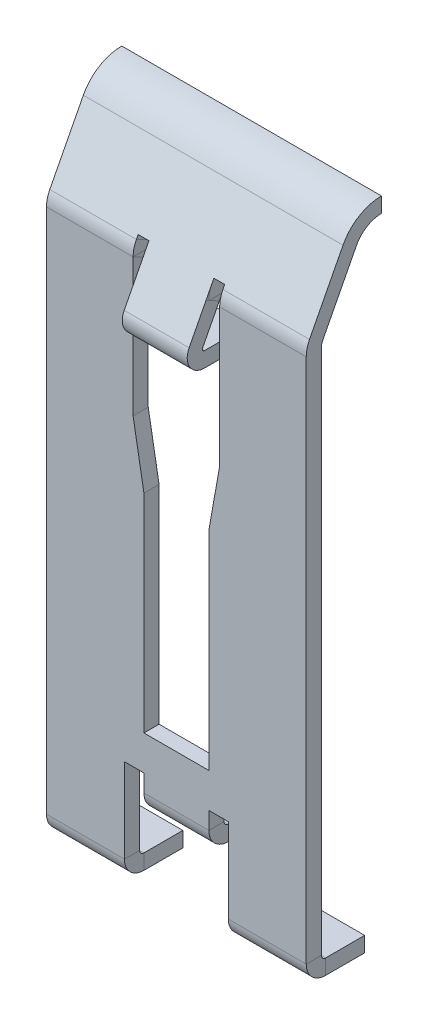
from build123d import *

# Parameters (mm, degrees)
MAIN_PLATE_DEPTH               = 0.35
EDGE_FLANGE1_STRIP_W           = 1.6
EDGE_FLANGE1_STRIP_H           = 0.35
EDGE_FLANGE1_STRIP_CUT_DEPTH   = 1.8
EDGE_FLANGE1_STRIP_2_W         = 1.6
EDGE_FLANGE1_STRIP_2_H         = 0.35
EDGE_FLANGE1_STRIP_CUT_2_DEPTH = 1.8
EDGE_FLANGE1_STRIP_3_W         = 1.6
EDGE_FLANGE1_STRIP_3_H         = 0.35
EDGE_FLANGE1_STRIP_CUT_3_DEPTH = 1.5
EDGE_FLANGE1_DEPTH             = 1.8
EDGE_FLANGE1_BEND_DEPTH        = 1.8
EDGE_FLANGE1_BEND_2_DEPTH      = 1.5
CENTRAL_SECTION_DEPTH          = 0.75
BOSS_EXTRUDE3_DEPTH            = 2.25
BOSS_EXTRUDE4_START            = -2.25
BOSS_EXTRUDE4_DEPTH            = 2.25
SKETCH20_W                     = 0.25
SKETCH20_H                     = 0.4
CUT_EXTRUDE1_DEPTH             = 1


# Sheet-metal steps are written as plain solids
with BuildPart() as part:
    # Sketch1 → Main Plate (new body)
    with BuildSketch(Plane.XY):
        Polygon((-3, 9.4), (-3, -2.85), (-1.2, -2.85), (-1.2, -0.8), (-0.75, -0.8), (-0.75, -1.3), (0.75, -1.3), (0.75, -0.8), (1.2, -0.8), (1.2, -2.85), (3, -2.85), (3, 9.4), (1, 9.4), (1, 6.217820455), (0.75, 4.8), (0.75, 0), (-0.75, 0), (-0.75, 4.8), (-1, 6.217820455), (-1, 9.4), align=None)
    extrude(amount=-MAIN_PLATE_DEPTH)

    # Edge-Flange1 strip (across the edge) → Edge-Flange1 strip cut (cut)
    with BuildSketch(Plane(origin=(3, -2.85, -0.35), x_dir=(0, 1, 0), z_dir=(-1, 0, 0))):
        with Locations((-0.7, -0.175)):
            Rectangle(EDGE_FLANGE1_STRIP_W, EDGE_FLANGE1_STRIP_H)
    extrude(amount=EDGE_FLANGE1_STRIP_CUT_DEPTH, mode=Mode.SUBTRACT)

    # Edge-Flange1 strip 2 (across the edge) → Edge-Flange1 strip cut 2 (cut)
    with BuildSketch(Plane(origin=(-1.2, -2.85, -0.35), x_dir=(0, 1, 0), z_dir=(-1, 0, 0))):
        with Locations((-0.7, -0.175)):
            Rectangle(EDGE_FLANGE1_STRIP_2_W, EDGE_FLANGE1_STRIP_2_H)
    extrude(amount=EDGE_FLANGE1_STRIP_CUT_2_DEPTH, mode=Mode.SUBTRACT)

    # Edge-Flange1 strip 3 (across the edge) → Edge-Flange1 strip cut 3 (cut)
    with BuildSketch(Plane(origin=(0.75, -1.3, -0.35), x_dir=(0, 1, 0), z_dir=(-1, 0, 0))):
        with Locations((-0.7, -0.175)):
            Rectangle(EDGE_FLANGE1_STRIP_3_W, EDGE_FLANGE1_STRIP_3_H)
    extrude(amount=EDGE_FLANGE1_STRIP_CUT_3_DEPTH, mode=Mode.SUBTRACT)

    # Edge-Flange1 section (across the edge) → Edge-Flange1 (add)
    with BuildSketch(Plane(origin=(3, -2.85, -0.35), x_dir=(0, 1, 0), z_dir=(-1, 0, 0))):
        with BuildLine():
            Line((-0.35, 0.1), (-0.35, 1))
            Line((-0.35, 1), (0, 1))
            Line((0, 1), (0, 0.1))
            ThreePointArc((0, 0.1), (0.029289322, 0.029289322), (0.1, 0))
            Line((0.1, 0), (0.1, -0.35))
            ThreePointArc((0.1, -0.35), (-0.218198052, -0.218198052), (-0.35, 0.1))
        make_face()
    extrude(amount=EDGE_FLANGE1_DEPTH)

    # Edge-Flange1 section 2 (across the edge) → Edge-Flange1 bend (add)
    with BuildSketch(Plane(origin=(-1.2, -2.85, -0.35), x_dir=(0, 1, 0), z_dir=(-1, 0, 0))):
        with BuildLine():
            Line((-0.35, 0.1), (-0.35, 1))
            Line((-0.35, 1), (0, 1))
            Line((0, 1), (0, 0.1))
            ThreePointArc((0, 0.1), (0.029289322, 0.029289322), (0.1, 0))
            Line((0.1, 0), (0.1, -0.35))
            ThreePointArc((0.1, -0.35), (-0.218198052, -0.218198052), (-0.35, 0.1))
        make_face()
    extrude(amount=EDGE_FLANGE1_BEND_DEPTH)

    # Edge-Flange1 section 3 (across the edge) → Edge-Flange1 bend 2 (add)
    with BuildSketch(Plane(origin=(0.75, -1.3, -0.35), x_dir=(0, 1, 0), z_dir=(-1, 0, 0))):
        with BuildLine():
            Line((-0.35, 0.1), (-0.35, 1))
            Line((-0.35, 1), (0, 1))
            Line((0, 1), (0, 0.1))
            ThreePointArc((0, 0.1), (0.029289322, 0.029289322), (0.1, 0))
            Line((0.1, 0), (0.1, -0.35))
            ThreePointArc((0.1, -0.35), (-0.218198052, -0.218198052), (-0.35, 0.1))
        make_face()
    extrude(amount=EDGE_FLANGE1_BEND_2_DEPTH)



with BuildPart() as body_2:
    # Sketch15 → Central Section (new, symmetric)
    with BuildSketch(Plane(origin=(0, 0, 0), x_dir=(0, 0, -1), z_dir=(1, 0, 0))):
        with BuildLine():
            Line((0.9, 8.1), (0.9, 8.45))
            Line((0.9, 8.45), (-0.1, 8.45))
            ThreePointArc((-0.1, 8.45), (-0.14270772, 8.473999025), (-0.144417693, 8.522957973))
            Line((-0.144417693, 8.522957973), (1.160923854, 11.048453645))
            ThreePointArc((1.160923854, 11.048453645), (1.400341198, 11.305200355), (1.738353869, 11.4))
            Line((1.738353869, 11.4), (1.738353869, 11.75))
            ThreePointArc((1.738353869, 11.75), (1.218334376, 11.604154393), (0.85, 11.209159454))
            Line((0.85, 11.209159454), (-0.455341547, 8.683663782))
            ThreePointArc((-0.455341547, 8.683663782), (-0.441661757, 8.291992203), (-0.1, 8.1))
            Line((-0.1, 8.1), (0.9, 8.1))
        make_face()
    extrude(amount=CENTRAL_SECTION_DEPTH, both=True)


with BuildPart() as part_1:
    add(part.part)

    add(body_2.part)  # Boss-Extrude3 merges body 2
    # Sketch16 → Boss-Extrude3 (add)
    with BuildSketch(Plane(origin=(3, 0, 0), x_dir=(0, 0, -1), z_dir=(1, 0, 0))):
        with BuildLine():
            Line((0.35, 9.4), (0, 9.4))
            ThreePointArc((0, 9.4), (0.019169334, 9.55996991), (0.075591878, 9.710881579))
            Line((0.075591878, 9.710881579), (0.85, 11.209159454))
            ThreePointArc((0.85, 11.209159454), (1.218334376, 11.604154393), (1.738353869, 11.75))
            Line((1.738353869, 11.75), (1.738353869, 11.4))
            ThreePointArc((1.738353869, 11.4), (1.400341198, 11.305200355), (1.160923854, 11.048453645))
            Line((1.160923854, 11.048453645), (0.386515732, 9.55017577))
            ThreePointArc((0.386515732, 9.55017577), (0.359260019, 9.477275741), (0.35, 9.4))
        make_face()
    extrude(amount=-BOSS_EXTRUDE3_DEPTH)

    # Sketch19 → Boss-Extrude4 (add)
    with BuildSketch(Plane.ZY.offset(3).offset(BOSS_EXTRUDE4_START)):
        with BuildLine():
            Line((-0.35, 9.4), (0, 9.4))
            ThreePointArc((0, 9.4), (-0.019169334, 9.55996991), (-0.075591878, 9.710881579))
            Line((-0.075591878, 9.710881579), (-0.85, 11.209159454))
            ThreePointArc((-0.85, 11.209159454), (-1.218334376, 11.604154393), (-1.738353869, 11.75))
            Line((-1.738353869, 11.75), (-1.738353869, 11.4))
            ThreePointArc((-1.738353869, 11.4), (-1.400341198, 11.305200355), (-1.160923854, 11.048453645))
            Line((-1.160923854, 11.048453645), (-0.386515732, 9.55017577))
            ThreePointArc((-0.386515732, 9.55017577), (-0.359260019, 9.477275741), (-0.35, 9.4))
        make_face()
    extrude(amount=BOSS_EXTRUDE4_DEPTH)

    # Sketch20 → Cut-Extrude1 (cut)
    with BuildSketch(Plane(origin=(0, 2.016486324, 3.901375463), x_dir=(1, 0, 0), z_dir=(0, 0.4591594538479162, 0.8883538686481212))):
        with Locations((0.875, 8.550526365)):
            Rectangle(SKETCH20_W, SKETCH20_H)
        with Locations((-0.875, 8.550526365)):
            Rectangle(SKETCH20_W, SKETCH20_H)
    extrude(amount=-CUT_EXTRUDE1_DEPTH, mode=Mode.SUBTRACT)


solid = part_1.part
